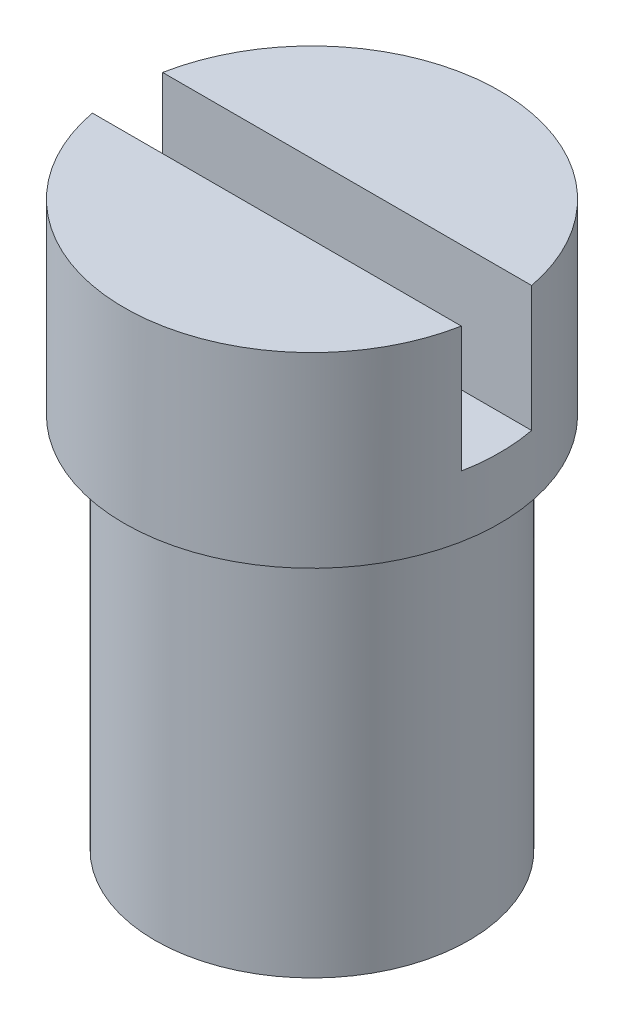
from build123d import *

# Parameters (mm, degrees)
SKETCH1_R           = 2.3749
BOSS_EXTRUDE1_DEPTH = 2.3622
SKETCH2_R           = 1.984375
BOSS_EXTRUDE2_DEPTH = 4.7625
SKETCH3_W           = 4.7498
SKETCH3_H           = 0.889
CUT_EXTRUDE1_DEPTH  = 1.5875


with BuildPart() as part:
    # Sketch1 → Boss-Extrude1 (new body)
    with BuildSketch(Plane(origin=(0, 0, 0), x_dir=(1, 0, 0), z_dir=(0, 1, 0))):
        Circle(SKETCH1_R)
    extrude(amount=BOSS_EXTRUDE1_DEPTH)

    # Sketch2 → Boss-Extrude2 (add)
    with BuildSketch(Plane(origin=(0, 0, 0), x_dir=(-1, 0, 0), z_dir=(0, -1, 0))):
        Circle(SKETCH2_R)
    extrude(amount=BOSS_EXTRUDE2_DEPTH)

    # Sketch3 → Cut-Extrude1 (cut)
    with BuildSketch(Plane(origin=(0, 2.3622, 0), x_dir=(1, 0, 0), z_dir=(0, 1, 0))):
        Rectangle(SKETCH3_W, SKETCH3_H)
    extrude(amount=-CUT_EXTRUDE1_DEPTH, mode=Mode.SUBTRACT)


solid = part.part
